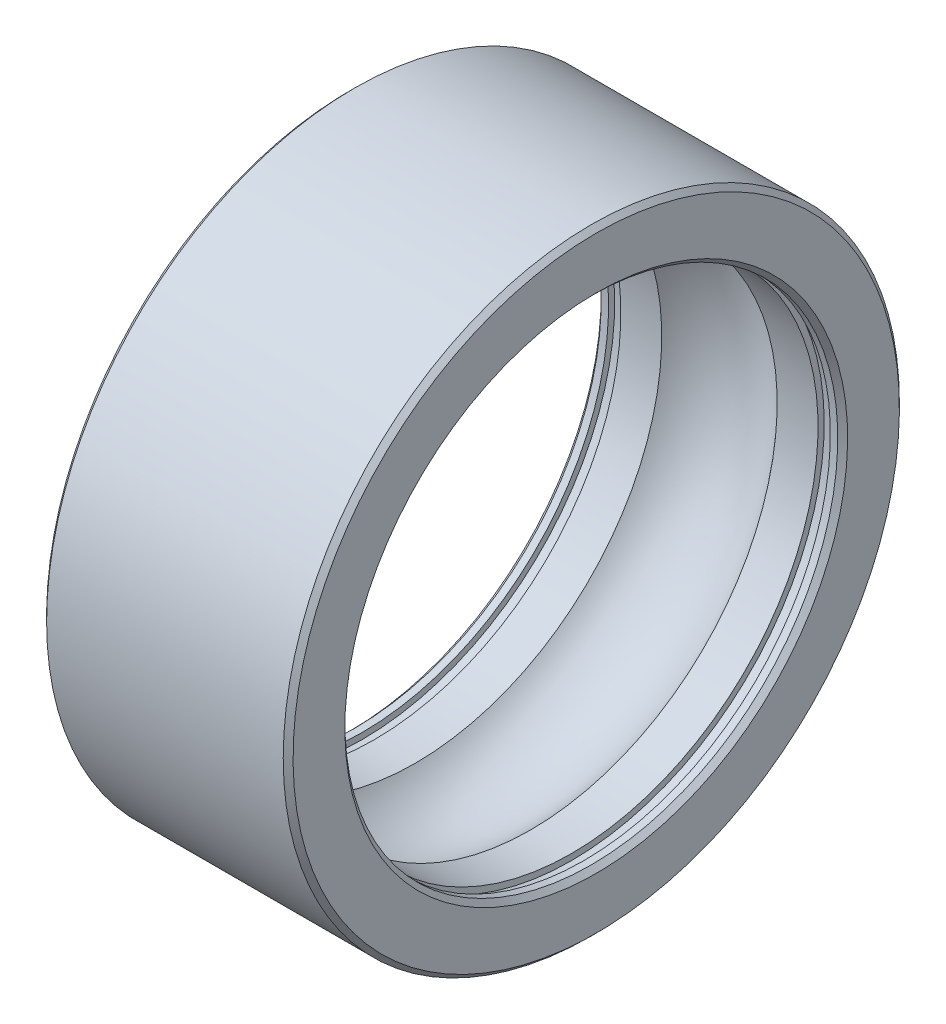
from build123d import *

# Parameters (mm, degrees)
CHAMFER1_SIZE = 0.08


with BuildPart() as part:
    # Sketch1 → Revolve1 (revolve)
    with BuildSketch(Plane.XY):
        with BuildLine():
            Line((-1.6, -4), (-0.9367497, -4))
            ThreePointArc((-0.9367497, -4), (0, -4.45), (0.9367497, -4))
            Line((0.9367497, -4), (1.6, -4))
            Line((1.6, -4), (1.6, -4.1))
            Line((1.6, -4.1), (1.8, -4.1))
            Line((1.8, -4.1), (1.8, -4))
            Line((1.8, -4), (2, -4))
            Line((2, -4), (2, -5))
            Line((2, -5), (-2, -5))
            Line((-2, -5), (-2, -4))
            Line((-2, -4), (-1.8, -4))
            Line((-1.8, -4), (-1.8, -4.1))
            Line((-1.8, -4.1), (-1.6, -4.1))
            Line((-1.6, -4.1), (-1.6, -4))
        make_face()
    revolve(axis=Axis((-6.429017492, 0, 0), (1, 0, 0)))

    # Chamfer1
    chamfer1_edges = [part.edges().sort_by_distance(p)[0] for p in [
        (2, 4, 0),
        (-2, 4, 0),
        (2, 5, 0),
        (-2, 5, 0),
    ]]
    chamfer(chamfer1_edges, length=CHAMFER1_SIZE)


solid = part.part
